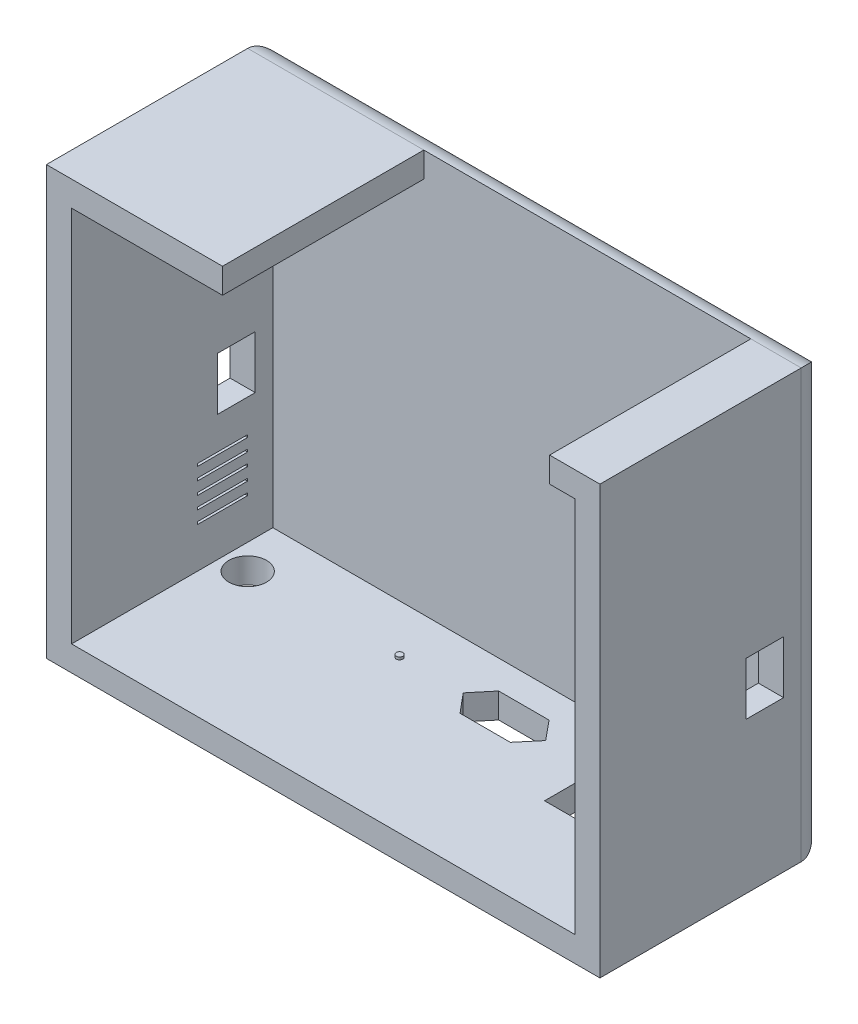
from build123d import *

# Parameters (mm, degrees)
SKETCH1_W                = 220
SKETCH1_H                = 170
BOSS_EXTRUDE1_DEPTH      = 100
SKETCH3_W                = 200
SKETCH3_H                = 150
CUT_EXTRUDE2_DEPTH       = 90
FILLET1_R                = 10
SKETCH4_W                = 130
SKETCH4_H                = 90
CUT_EXTRUDE3_DEPTH       = 10
SKETCH8_W                = 223.528125383
SKETCH8_H                = 171.877504909
CUT_EXTRUDE5_DEPTH       = 10
CUT_EXTRUDE7_REACH       = 505.38
SKETCH9_R                = 7.5
CUT_EXTRUDE8_REACH       = 505.38
SKETCH10_W               = 50
SKETCH10_H               = 30
CUT_EXTRUDE9_REACH       = 384.733
SKETCH11_W               = 20
SKETCH11_H               = 1
CUT_EXTRUDE10_REACH      = 505.38
CUT_EXTRUDE11_DEPTH      = 10
CUT_EXTRUDE12_REACH      = 505.38
SKETCH15_R               = 5.863278905
CUT_EXTRUDE13_DEPTH      = 8
BOSS_EXTRUDE3_DEPTH      = 8
BOSS_EXTRUDE3_DEPTH_BACK = 3
SKETCH16_R               = 1.3
SKETCH17_R               = 13.825952239
SKETCH17_R_2             = 5.825952239
EXTRUDE_THIN1_DEPTH      = 8
FILLET2_R                = 8
SKETCH18_W               = 15
SKETCH18_H               = 21
CUT_EXTRUDE14_DEPTH      = 249


with BuildPart() as part:
    # Sketch1 → Boss-Extrude1 (new body)
    with BuildSketch(Plane.XY):
        with Locations((-355.179344655, 214.973620006)):
            Rectangle(SKETCH1_W, SKETCH1_H)
    extrude(amount=BOSS_EXTRUDE1_DEPTH)

    # Sketch3 → Cut-Extrude2 (cut)
    with BuildSketch(Plane.XY.offset(100)):
        with Locations((-355.179344655, 214.973620006)):
            Rectangle(SKETCH3_W, SKETCH3_H)
    extrude(amount=-CUT_EXTRUDE2_DEPTH, mode=Mode.SUBTRACT)

    # Fillet1
    fillet1_edges = [part.edges().sort_by_distance(p)[0] for p in [
        (-355.179344655, 299.973620006, 0),
        (-245.179344655, 214.973620006, 0),
        (-355.179344655, 129.973620006, 0),
        (-465.179344655, 214.973620006, 0),
    ]]
    fillet(fillet1_edges, radius=FILLET1_R)

    # Sketch4 → Cut-Extrude3 (cut)
    with BuildSketch(Plane(origin=(0, 299.973620006, 0), x_dir=(1, 0, 0), z_dir=(0, 1, 0))):
        with Locations((-330.179344655, -55)):
            Rectangle(SKETCH4_W, SKETCH4_H)
    extrude(amount=-CUT_EXTRUDE3_DEPTH, mode=Mode.SUBTRACT)

    # Sketch8 → Cut-Extrude5 (cut)
    with BuildSketch(Plane.XY.offset(90)):
        with Locations((-354.80209528, 215.143634814)):
            Rectangle(SKETCH8_W, SKETCH8_H)
    extrude(amount=CUT_EXTRUDE5_DEPTH, mode=Mode.SUBTRACT)

    # Sketch9 → Cut-Extrude7 (cut, up to next)
    with BuildSketch(Plane.XZ.offset(-129.973620006), mode=Mode.PRIVATE) as cut_extrude7_sk1:
        with Locations(Location((-445.179344655, 30, 0), (0, 0, 270))):
            Circle(SKETCH9_R)
    cut_extrude7_tool1 = extrude(cut_extrude7_sk1.sketch, amount=-CUT_EXTRUDE7_REACH, mode=Mode.PRIVATE) & part.part
    add(cut_extrude7_tool1.solids().sort_by_distance((-445.179345, 129.97362, 30))[0], mode=Mode.SUBTRACT)

    # Sketch10 → Cut-Extrude8 (cut, up to next)
    with BuildSketch(Plane.XZ.offset(-129.973620006), mode=Mode.PRIVATE) as cut_extrude8_sk1:
        with Locations((-282.179344655, 35)):
            Rectangle(SKETCH10_W, SKETCH10_H)
    cut_extrude8_tool1 = extrude(cut_extrude8_sk1.sketch, amount=-CUT_EXTRUDE8_REACH, mode=Mode.PRIVATE) & part.part
    add(cut_extrude8_tool1.solids().sort_by_distance((-282.179345, 129.97362, 35))[0], mode=Mode.SUBTRACT)

    # Sketch11 → Cut-Extrude9 (cut, up to next)
    with BuildSketch(Plane.ZY.offset(465.179344655), mode=Mode.PRIVATE) as cut_extrude9_sk1:
        with Locations((30.04058668, 161.535899553)):
            Rectangle(SKETCH11_W, SKETCH11_H)
    cut_extrude9_tool1 = extrude(cut_extrude9_sk1.sketch, amount=-CUT_EXTRUDE9_REACH, mode=Mode.PRIVATE) & part.part
    # Sketch11 → Cut-Extrude9 (cut, up to next)
    with BuildSketch(Plane.ZY.offset(465.179344655), mode=Mode.PRIVATE) as cut_extrude9_sk2:
        with Locations((30.04058668, 156.535899553)):
            Rectangle(SKETCH11_W, SKETCH11_H)
    cut_extrude9_tool2 = extrude(cut_extrude9_sk2.sketch, amount=-CUT_EXTRUDE9_REACH, mode=Mode.PRIVATE) & part.part
    # Sketch11 → Cut-Extrude9 (cut, up to next)
    with BuildSketch(Plane.ZY.offset(465.179344655), mode=Mode.PRIVATE) as cut_extrude9_sk3:
        with Locations((30.04058668, 166.535899553)):
            Rectangle(SKETCH11_W, SKETCH11_H)
    cut_extrude9_tool3 = extrude(cut_extrude9_sk3.sketch, amount=-CUT_EXTRUDE9_REACH, mode=Mode.PRIVATE) & part.part
    # Sketch11 → Cut-Extrude9 (cut, up to next)
    with BuildSketch(Plane.ZY.offset(465.179344655), mode=Mode.PRIVATE) as cut_extrude9_sk4:
        with Locations((30.04058668, 171.535899553)):
            Rectangle(SKETCH11_W, SKETCH11_H)
    cut_extrude9_tool4 = extrude(cut_extrude9_sk4.sketch, amount=-CUT_EXTRUDE9_REACH, mode=Mode.PRIVATE) & part.part
    # Sketch11 → Cut-Extrude9 (cut, up to next)
    with BuildSketch(Plane.ZY.offset(465.179344655), mode=Mode.PRIVATE) as cut_extrude9_sk5:
        with Locations((30.04058668, 176.535899553)):
            Rectangle(SKETCH11_W, SKETCH11_H)
    cut_extrude9_tool5 = extrude(cut_extrude9_sk5.sketch, amount=-CUT_EXTRUDE9_REACH, mode=Mode.PRIVATE) & part.part
    add(cut_extrude9_tool1.solids().sort_by_distance((-465.179345, 161.5359, 30.040587))[0], mode=Mode.SUBTRACT)
    add(cut_extrude9_tool2.solids().sort_by_distance((-465.179345, 156.5359, 30.040587))[0], mode=Mode.SUBTRACT)
    add(cut_extrude9_tool3.solids().sort_by_distance((-465.179345, 166.5359, 30.040587))[0], mode=Mode.SUBTRACT)
    add(cut_extrude9_tool4.solids().sort_by_distance((-465.179345, 171.5359, 30.040587))[0], mode=Mode.SUBTRACT)
    add(cut_extrude9_tool5.solids().sort_by_distance((-465.179345, 176.5359, 30.040587))[0], mode=Mode.SUBTRACT)

    # Sketch12 → Cut-Extrude10 (cut, up to next)
    with BuildSketch(Plane.XZ.offset(-129.973620006), mode=Mode.PRIVATE) as cut_extrude10_sk1:
        Polygon((-354.097719845, 36.683084204), (-334.097719845, 36.683084204), (-327.697719845, 29.055861211), (-335.358164277, 22.627985114), (-352.790666107, 22.627985114), (-360.497719845, 29.023338287), align=None)
    cut_extrude10_tool1 = extrude(cut_extrude10_sk1.sketch, amount=-CUT_EXTRUDE10_REACH, mode=Mode.PRIVATE) & part.part
    add(cut_extrude10_tool1.solids().sort_by_distance((-344.093749, 129.97362, 29.715571))[0], mode=Mode.SUBTRACT)

    # Sketch13 → Cut-Extrude11 (cut)
    with BuildSketch(Plane.XZ.offset(-129.973620006)):
        Polygon((-360.497719845, 29.023338287), (-354.110242897, 21.329175679), (-354.11397805, 22.529175679), (-354.117713203, 23.729175679), align=None)
        Polygon((-334.045816465, 21.329175679), (-327.697719845, 29.055861211), (-334.045816465, 23.729175679), (-334.045816465, 22.627985114), align=None)
    extrude(amount=-CUT_EXTRUDE11_DEPTH, mode=Mode.SUBTRACT)

    # Sketch14 → Cut-Extrude12 (cut, up to next)
    with BuildSketch(Plane.XZ.offset(-129.973620006), mode=Mode.PRIVATE) as cut_extrude12_sk1:
        Polygon((-354.117713203, 23.729175679), (-354.110242897, 21.329175679), (-334.045816465, 21.329175679), (-334.045816465, 23.729175679), align=None)
    cut_extrude12_tool1 = extrude(cut_extrude12_sk1.sketch, amount=-CUT_EXTRUDE12_REACH, mode=Mode.PRIVATE) & part.part
    add(cut_extrude12_tool1.solids().sort_by_distance((-344.079897, 129.97362, 22.52925))[0], mode=Mode.SUBTRACT)

    # Sketch15 → Cut-Extrude13 (cut)
    with BuildSketch(Plane.XZ.offset(-129.973620006)):
        with Locations(Location((-385.408718364, 29.414099171, 0), (0, 0, 270))):
            Circle(SKETCH15_R)
    extrude(amount=-CUT_EXTRUDE13_DEPTH, mode=Mode.SUBTRACT)

    # Sketch16 → Boss-Extrude3 (add, two sides: drawn at the far end of the back side and taken through both)
    with BuildSketch(Plane.XZ.offset(-137.973620006).offset(-BOSS_EXTRUDE3_DEPTH_BACK)):
        with Locations(Location((-385.408718364, 29.414099171, 0), (0, 0, 270))):
            Circle(SKETCH16_R)
    extrude(amount=BOSS_EXTRUDE3_DEPTH + BOSS_EXTRUDE3_DEPTH_BACK)

    # Sketch17 → Extrude-Thin1 (add)
    with BuildSketch(Plane.XZ.offset(-129.973620006)):
        with Locations((-385.408718364, 29.414099171)):
            Circle(SKETCH17_R)
        with Locations((-385.408718364, 29.414099171)):
            Circle(SKETCH17_R_2, mode=Mode.SUBTRACT)
    extrude(amount=EXTRUDE_THIN1_DEPTH)

    # Fillet2
    fillet2_edges = [part.edges().sort_by_distance(p)[0] for p in [
        (-399.234670603, 121.973620006, 29.414099171),
    ]]
    fillet(fillet2_edges, radius=FILLET2_R - 0.0001)  # a hair under: the kernel refuses the full size

    # Sketch18 → Cut-Extrude14 (cut)
    with BuildSketch(Plane(origin=(-245.179344655, 0, 0), x_dir=(0, 0, -1), z_dir=(1, 0, 0))):
        with Locations((-24.5, 200.473620006)):
            Rectangle(SKETCH18_W, SKETCH18_H)
    extrude(amount=-CUT_EXTRUDE14_DEPTH, mode=Mode.SUBTRACT)


solid = part.part
